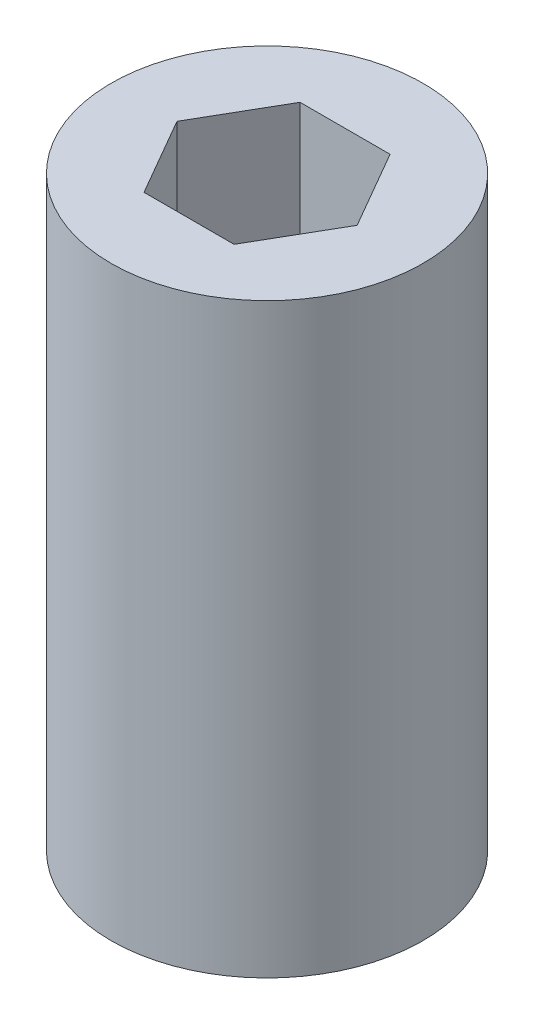
from build123d import *

# Parameters (mm, degrees)
SKETCH1_R           = 12.7
BOSS_EXTRUDE1_DEPTH = 47.752


with BuildPart() as part:
    # Sketch1 → Boss-Extrude1 (new body)
    with BuildSketch(Plane(origin=(0, 0, 0), x_dir=(1, 0, 0), z_dir=(0, 1, 0))):
        Circle(SKETCH1_R)
        Polygon((3.666174209, -6.35), (7.332348419, 0), (3.666174209, 6.35), (-3.666174209, 6.35), (-7.332348419, 0), (-3.666174209, -6.35), align=None, mode=Mode.SUBTRACT)
    extrude(amount=BOSS_EXTRUDE1_DEPTH)


solid = part.part
